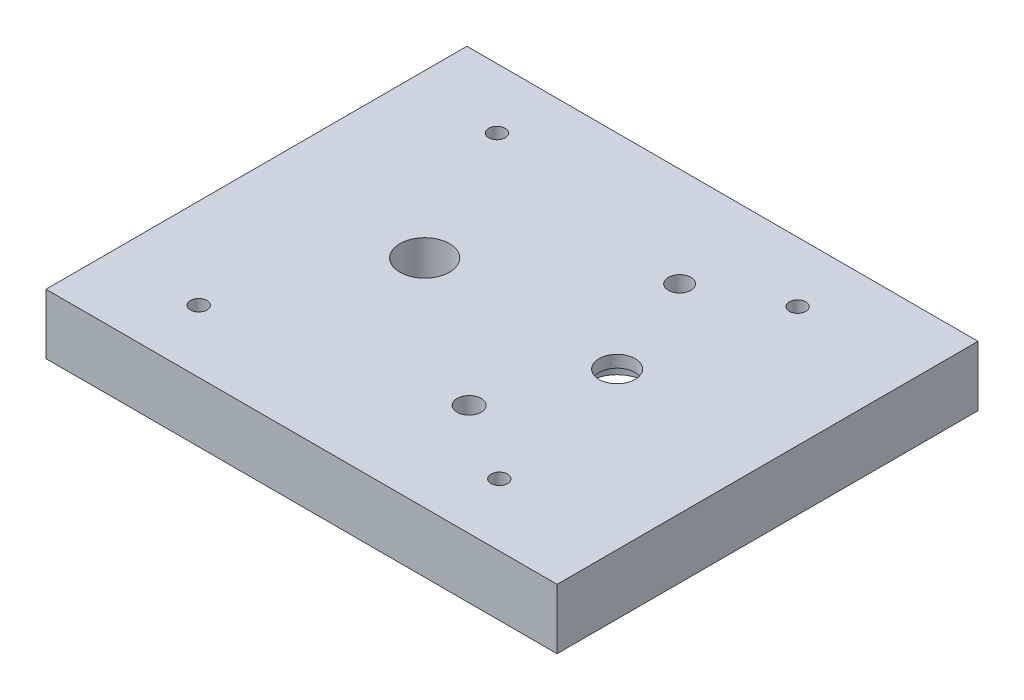
from build123d import *

# Parameters (mm, degrees)
SKETCH1_W           = 85
SKETCH1_H           = 70
SKETCH1_R           = 1.375
SKETCH1_R_2         = 1.875
SKETCH1_R_3         = 2
SKETCH1_W_2         = 2.231847436
SKETCH1_H_2         = 6.309819942
SKETCH1_R_4         = 4.125
SKETCH1_R_5         = 3
BOSS_EXTRUDE4_DEPTH = 10
SKETCH1_7_R         = 4.5
CUT_EXTRUDE2_DEPTH  = 6
SKETCH1_9_R         = 2
SKETCH1_9_R_2       = 1.875
SKETCH1_9_R_3       = 4.5
CUT_EXTRUDE6_DEPTH  = 6
SKETCH1_11_R        = 4.5
SKETCH1_11_R_2      = 3
CUT_EXTRUDE10_DEPTH = 8
SKETCH5_W           = 2.231847436
SKETCH5_H           = 6.309819942
BOSS_EXTRUDE5_DEPTH = 4


with BuildPart() as part:
    # Sketch1 → Boss-Extrude4 (new body)
    with BuildSketch(Plane(origin=(0, 0, 0), x_dir=(1, 0, 0), z_dir=(0, 1, 0))):
        Rectangle(SKETCH1_W, SKETCH1_H)
        with Locations((-27.5, -24.60667729)):
            Circle(SKETCH1_R, mode=Mode.SUBTRACT)
        with Locations((22.5, -24.60667729)):
            Circle(SKETCH1_R, mode=Mode.SUBTRACT)
        with Locations((-27.5, 25)):
            Circle(SKETCH1_R, mode=Mode.SUBTRACT)
        with Locations((22.5, 25)):
            Circle(SKETCH1_R, mode=Mode.SUBTRACT)
        with Locations((9.407211052, 18.471043068)):
            Circle(SKETCH1_R_2, mode=Mode.SUBTRACT)
        with Locations((9.401398241, -16.528956449)):
            Circle(SKETCH1_R_3, mode=Mode.SUBTRACT)
        with Locations((-8.615923718, 1)):
            Rectangle(SKETCH1_W_2, SKETCH1_H_2, mode=Mode.SUBTRACT)
        with Locations((-15.52, 1)):
            Circle(SKETCH1_R_4, mode=Mode.SUBTRACT)
        with Locations((16.478339488, 0.999882702)):
            Circle(SKETCH1_R_5, mode=Mode.SUBTRACT)
    extrude(amount=BOSS_EXTRUDE4_DEPTH)

    # Sketch1<7> → Cut-Extrude2 (cut)
    with BuildSketch(Plane(origin=(0, 0, 0), x_dir=(1, 0, 0), z_dir=(0, 1, 0))):
        with Locations((16.478339488, 0.999882702)):
            Circle(SKETCH1_7_R)
    extrude(amount=CUT_EXTRUDE2_DEPTH, mode=Mode.SUBTRACT)

    # Sketch1<9> → Cut-Extrude6 (cut)
    with BuildSketch(Plane(origin=(0, 0, 0), x_dir=(1, 0, 0), z_dir=(0, 1, 0))):
        with BuildLine():
            Line((12.907211052, 14.57906156), (12.907211052, 18.471043068))
            ThreePointArc((12.907211052, 18.471043068), (9.407211052, 21.971043068), (5.907211052, 18.471043068))
            Line((5.907211052, 18.471043068), (5.907211052, 14.531144356))
            ThreePointArc((5.907211052, 14.531144356), (0.989940056, 12.116603787), (-2.624355653, 8))
            Line((-2.624355653, 8), (-7.5, 8))
            Line((-7.5, 8), (-7.5, 4.154909971))
            Line((-7.5, 4.154909971), (-9.731847436, 4.154909971))
            Line((-9.731847436, 4.154909971), (-9.731847436, -2.154909971))
            Line((-9.731847436, -2.154909971), (-7.5, -2.154909971))
            Line((-7.5, -2.154909971), (-7.5, -6))
            Line((-7.5, -6), (-2.624355653, -6))
            ThreePointArc((-2.624355653, -6), (0.987552339, -10.114775518), (5.901398241, -12.529599602))
            Line((5.901398241, -12.529599602), (5.901398241, -16.528956449))
            ThreePointArc((5.901398241, -16.528956449), (9.401398241, -20.028956449), (12.901398241, -16.528956449))
            Line((12.901398241, -16.528956449), (12.901398241, -12.580518768))
            ThreePointArc((12.901398241, -12.580518768), (23.499999679, 0.99700366), (12.907211052, 14.57906156))
        make_face()
        with Locations((9.401398241, -16.528956449)):
            Circle(SKETCH1_9_R, mode=Mode.SUBTRACT)
        with Locations((9.407211052, 18.471043068)):
            Circle(SKETCH1_9_R_2, mode=Mode.SUBTRACT)
        with Locations((16.478339488, 0.999882702)):
            Circle(SKETCH1_9_R_3, mode=Mode.SUBTRACT)
    extrude(amount=CUT_EXTRUDE6_DEPTH, mode=Mode.SUBTRACT)

    # Sketch1<11> → Cut-Extrude10 (cut)
    with BuildSketch(Plane(origin=(0, 0, 0), x_dir=(1, 0, 0), z_dir=(0, 1, 0))):
        with Locations((16.478339488, 0.999882702)):
            Circle(SKETCH1_11_R)
        with Locations((16.478339488, 0.999882702)):
            Circle(SKETCH1_11_R_2, mode=Mode.SUBTRACT)
    extrude(amount=CUT_EXTRUDE10_DEPTH, mode=Mode.SUBTRACT)

    # Sketch5 → Boss-Extrude5 (add)
    with BuildSketch(Plane(origin=(0, 10, 0), x_dir=(1, 0, 0), z_dir=(0, 1, 0))):
        with Locations((-8.615923718, 1)):
            Rectangle(SKETCH5_W, SKETCH5_H)
    extrude(amount=-BOSS_EXTRUDE5_DEPTH)


solid = part.part
